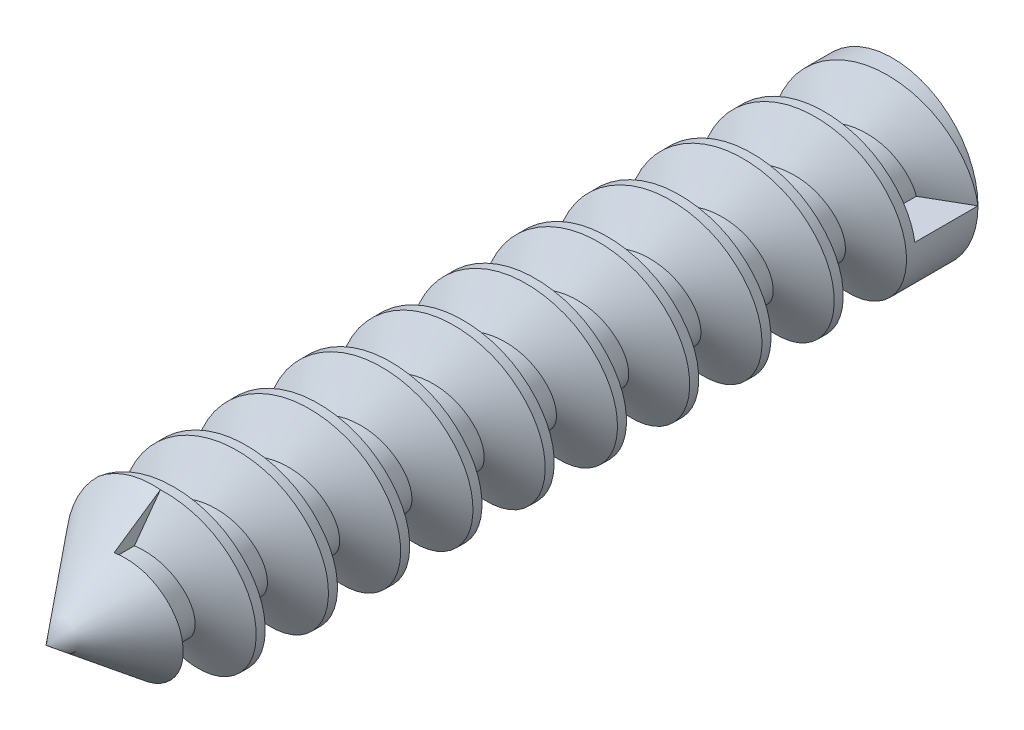
from build123d import *
from build123d.topology import SkipClean

# Parameters (mm, degrees)
SKETCH_1_R      = 1.5
EXTRUDE_1_DEPTH = 13
THREAD_1_PITCH  = 1.27


with BuildPart() as part:
    # Sketch 1 → 凸台-拉伸1 (new body)
    with BuildSketch(Plane.XY):
        with Locations(Location((0, 0, 0), (0, 0, 180))):
            Circle(SKETCH_1_R)
    extrude(amount=EXTRUDE_1_DEPTH)

    # 草图2 → 旋转1 (revolve)
    with BuildSketch(Plane(origin=(0, 0, 0), x_dir=(1, 0, 0), z_dir=(0, 1, 0))):
        Polygon((0, -13), (0, -14.88154389), (-1.5, -13), align=None)
    revolve(axis=Axis((0, 0, 13), (0, 0, 1)))

    # 螺纹线1: the profile of Sketch 1 2 profile screwed along a right-hand helix of 10.23622 turns, 8 arcs to a turn; built about Z, then put on its axis
    with SkipClean():  # the faces are left unmerged after this step: merging them gives an invalid solid
        thread_1_z = Axis((0, 0, 0), (0, 0, 1))
        thread_1_corners = [(1.5003, 0, -0.000173205), (1.5003, 0, 1.111423202), (0.812592339, 0, 0.714374998), (0.812592339, 0, 0.396874998)]
        with BuildLine(mode=Mode.PRIVATE) as thread_1_profile:
            Line(thread_1_corners[0], thread_1_corners[1])
            Line(thread_1_corners[1], thread_1_corners[2])
            Line(thread_1_corners[2], thread_1_corners[3])
            Line(thread_1_corners[3], thread_1_corners[0])
        thread_1_cap = Face(thread_1_profile.wire())
        thread_1_turn_angles = [0, 22.5, 45, 67.5, 90, 112.5, 135, 157.5, 180, 202.5, 225, 247.5, 270, 292.5, 315, 337.5, 360]
        thread_1_turn_weights = [1, 0.9238795325112867, 1, 0.9238795325112867, 1, 0.9238795325112867, 1, 0.9238795325112867, 1, 0.9238795325112867, 1, 0.9238795325112867, 1, 0.9238795325112867, 1, 0.9238795325112867, 1]
        thread_1_turn_rails = [Edge.make_bspline([Vector(p[0], p[1], 0).rotate(thread_1_z, thread_1_turn_angles[k]) / thread_1_turn_weights[k] + Vector(0, 0, p[2] + THREAD_1_PITCH * thread_1_turn_angles[k] / 360) for k in range(17)], [0, 0, 0, 1, 1, 2, 2, 3, 3, 4, 4, 5, 5, 6, 6, 7, 7, 8, 8, 8], 2, thread_1_turn_weights) for p in thread_1_corners]
        thread_1_turn_sides = [Face.make_surface_from_curves(thread_1_turn_rails[p[0]], thread_1_turn_rails[p[1]]) for p in [(0, 1), (1, 2), (2, 3), (3, 0)]]
        thread_1_last_angles = [3600, 3622.5, 3645, 3665.019685039, 3685.039370079]
        thread_1_last_weights = [1, 0.9238795325112867, 1, 0.9395750578945528, 1]
        thread_1_last_rails = [Edge.make_bspline([Vector(p[0], p[1], 0).rotate(thread_1_z, thread_1_last_angles[k]) / thread_1_last_weights[k] + Vector(0, 0, p[2] + THREAD_1_PITCH * thread_1_last_angles[k] / 360) for k in range(5)], [0, 0, 0, 1, 1, 2, 2, 2], 2, thread_1_last_weights) for p in thread_1_corners]
        thread_1_last_sides = [Face.make_surface_from_curves(thread_1_last_rails[p[0]], thread_1_last_rails[p[1]]) for p in [(0, 1), (1, 2), (2, 3), (3, 0)]]
        thread_1 = Plane(origin=(0, 0, 0), x_dir=(1, 0, 0), z_dir=(0, 0, 1)) * Solid(Shell([*[p.moved(Location((0, 0, THREAD_1_PITCH * i))) for i in range(10) for p in thread_1_turn_sides], *thread_1_last_sides, thread_1_cap, thread_1_cap.rotate(thread_1_z, 3685.039370079).moved(Location((0, 0, THREAD_1_PITCH * 3685.039370079 / 360)))]))
        add(thread_1, mode=Mode.SUBTRACT)


solid = part.part
